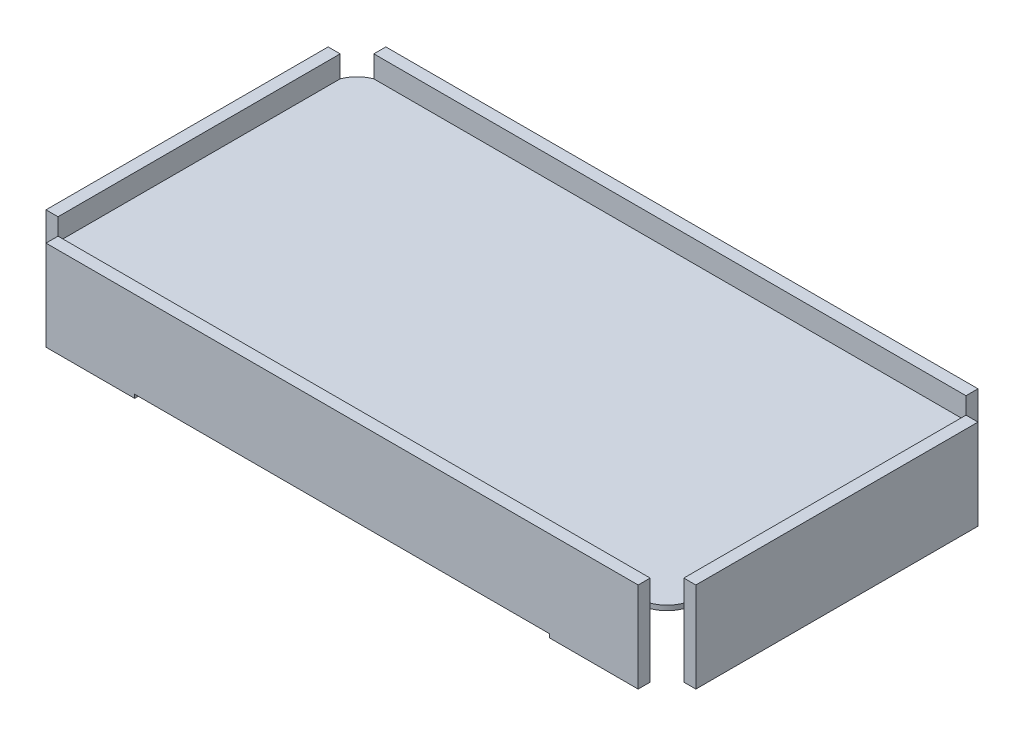
from build123d import *

# Parameters (mm, degrees)
SKETCH1_W             = 12.5
SKETCH1_H             = 293.5
BOSS_EXTRUDE1_DEPTH   = 93.8
SKETCH1_W_2           = 615.95
SKETCH1_H_2           = 12.5
BOSS_EXTRUDE1_2_DEPTH = 93.8
BOSS_EXTRUDE1_3_DEPTH = 93.8
BOSS_EXTRUDE1_4_DEPTH = 93.8
SKETCH2_W             = 650.95
SKETCH2_H             = 328.5
BOSS_EXTRUDE2_DEPTH   = 5
FILLET2_R             = 30
SKETCH4_W             = 215.725
SKETCH4_H             = 3.8
CUT_EXTRUDE1_DEPTH    = 498.983725261


with BuildPart() as part:
    # Sketch1 → Boss-Extrude1 (new body)
    with BuildSketch(Plane(origin=(0, 0, 0), x_dir=(1, 0, 0), z_dir=(0, 1, 0))):
        with Locations((-331.725, 0)):
            Rectangle(SKETCH1_W, SKETCH1_H)
    extrude(amount=BOSS_EXTRUDE1_DEPTH)



with BuildPart() as body_2:
    # Sketch1 → Boss-Extrude1 2 (new body)
    with BuildSketch(Plane(origin=(0, 0, 0), x_dir=(1, 0, 0), z_dir=(0, 1, 0))):
        with Locations((0, 170.5)):
            Rectangle(SKETCH1_W_2, SKETCH1_H_2)
    extrude(amount=BOSS_EXTRUDE1_2_DEPTH)


with BuildPart() as body_3:
    # Sketch1 → Boss-Extrude1 3 (new body)
    with BuildSketch(Plane(origin=(0, 0, 0), x_dir=(1, 0, 0), z_dir=(0, 1, 0))):
        with Locations((331.725, 0)):
            Rectangle(SKETCH1_W, SKETCH1_H)
    extrude(amount=BOSS_EXTRUDE1_3_DEPTH)


with BuildPart() as body_4:
    # Sketch1 → Boss-Extrude1 4 (new body)
    with BuildSketch(Plane(origin=(0, 0, 0), x_dir=(1, 0, 0), z_dir=(0, 1, 0))):
        with Locations((0, -170.5)):
            Rectangle(SKETCH1_W_2, SKETCH1_H_2)
    extrude(amount=BOSS_EXTRUDE1_4_DEPTH)


with BuildPart() as part_1:
    add(part.part)

    add(body_2.part)  # Boss-Extrude2 merges body 2

    add(body_3.part)  # Boss-Extrude2 merges body 3

    add(body_4.part)  # Boss-Extrude2 merges body 4
    # Sketch2 → Boss-Extrude2 (add)
    with BuildSketch(Plane(origin=(0, 71.25, 0), x_dir=(1, 0, 0), z_dir=(0, 1, 0))):
        Rectangle(SKETCH2_W, SKETCH2_H)
    extrude(amount=-BOSS_EXTRUDE2_DEPTH)

    # Fillet2
    # the kernel refuses this fillet: 30 mm, written as the material it takes off along each edge
    with BuildSketch(Plane(origin=(-325.475, 115, 164.25), x_dir=(1, 0, 0), z_dir=(0, -1, 0)), Plane(origin=(-325.475, 115, -164.25), x_dir=(0, 0, 1), z_dir=(0, -1, 0)), Plane(origin=(325.475, 115, -164.25), x_dir=(-1, 0, 0), z_dir=(0, -1, 0)), Plane(origin=(325.475, 115, 164.25), x_dir=(0, 0, -1), z_dir=(0, -1, 0))) as fillet2_piece_1:
        with BuildLine():
            CenterArc((28.074531042, -28.074531042), FILLET2_R, 110.63934566, 48.721308679)
            Line((0, -17.5), (0, 0))
            Line((0, 0), (17.5, 0))
        make_face()
    extrude(amount=92.5, mode=Mode.SUBTRACT)

    # Sketch4 → Cut-Extrude1 (cut, through all)
    with BuildSketch(Plane(origin=(0, 0, -176.75), x_dir=(-1, 0, 0), z_dir=(0, 0, -1))):
        with Locations((-107.8625, 1.9)):
            Rectangle(SKETCH4_W, SKETCH4_H)
        with Locations((107.8625, 1.9)):
            Rectangle(SKETCH4_W, SKETCH4_H)
    extrude(amount=-CUT_EXTRUDE1_DEPTH, mode=Mode.SUBTRACT)


solid = part_1.part
